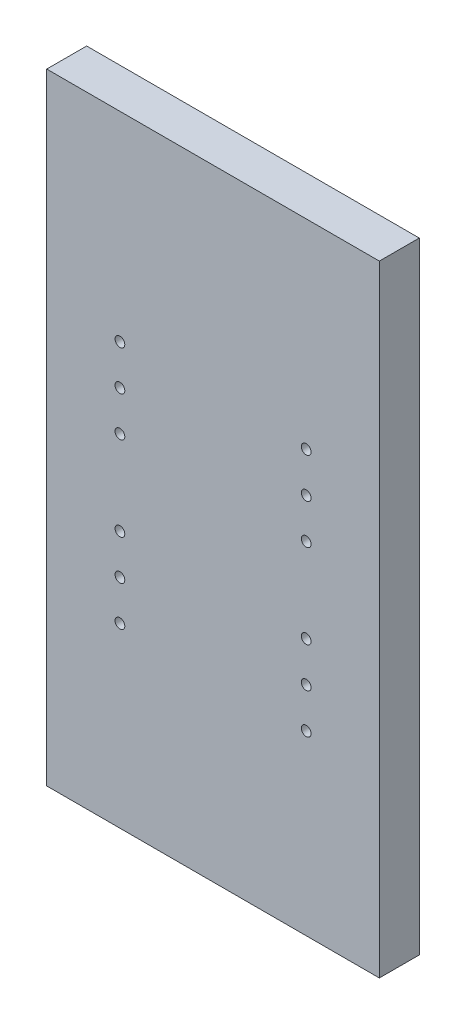
from build123d import *

# Parameters (mm, degrees)
BOSS_EXTRUDE1_DEPTH = 18
F_3DSKETCH2_R       = 2.2
CUT_EXTRUDE1_DEPTH  = 18


with BuildPart() as part:
    # 3DSketch1 → Boss-Extrude1 (new body)
    with BuildSketch(Plane(origin=(296.043137644, 1172.692882005, 0), x_dir=(-0.4722214125154188, -0.8814799700287822, 0), z_dir=(0, 0, 1))):
        Polygon((0, 0), (70.833211877, -132.221995504), (317.647603485, 0), (246.814391608, 132.221995504), align=None)
    extrude(amount=BOSS_EXTRUDE1_DEPTH)

    # 3DSketch2 → Cut-Extrude1 (cut)
    with BuildSketch(Plane(origin=(179.043137644, 1082.692882005, 20), x_dir=(0.6069136033622311, -0.7947678139267295, 0), z_dir=(0, 0, 1))):
        Circle(F_3DSKETCH2_R)
        with Locations((14.305820651, -10.924444861)):
            Circle(F_3DSKETCH2_R)
        with Locations((28.611641301, -21.848889721)):
            Circle(F_3DSKETCH2_R)
        with Locations((58.812818231, -44.911606649)):
            Circle(F_3DSKETCH2_R)
        with Locations((73.118638881, -55.836051509)):
            Circle(F_3DSKETCH2_R)
        with Locations((87.424459532, -66.76049637)):
            Circle(F_3DSKETCH2_R)
        with Locations((138.405202214, 0)):
            Circle(F_3DSKETCH2_R)
        with Locations((124.099381564, 10.924444861)):
            Circle(F_3DSKETCH2_R)
        with Locations((109.793560913, 21.848889721)):
            Circle(F_3DSKETCH2_R)
        with Locations((79.592383984, 44.911606649)):
            Circle(F_3DSKETCH2_R)
        with Locations((50.980742682, 66.76049637)):
            Circle(F_3DSKETCH2_R)
        with Locations((65.286563333, 55.836051509)):
            Circle(F_3DSKETCH2_R)
    extrude(amount=-CUT_EXTRUDE1_DEPTH, mode=Mode.SUBTRACT)


solid = part.part
